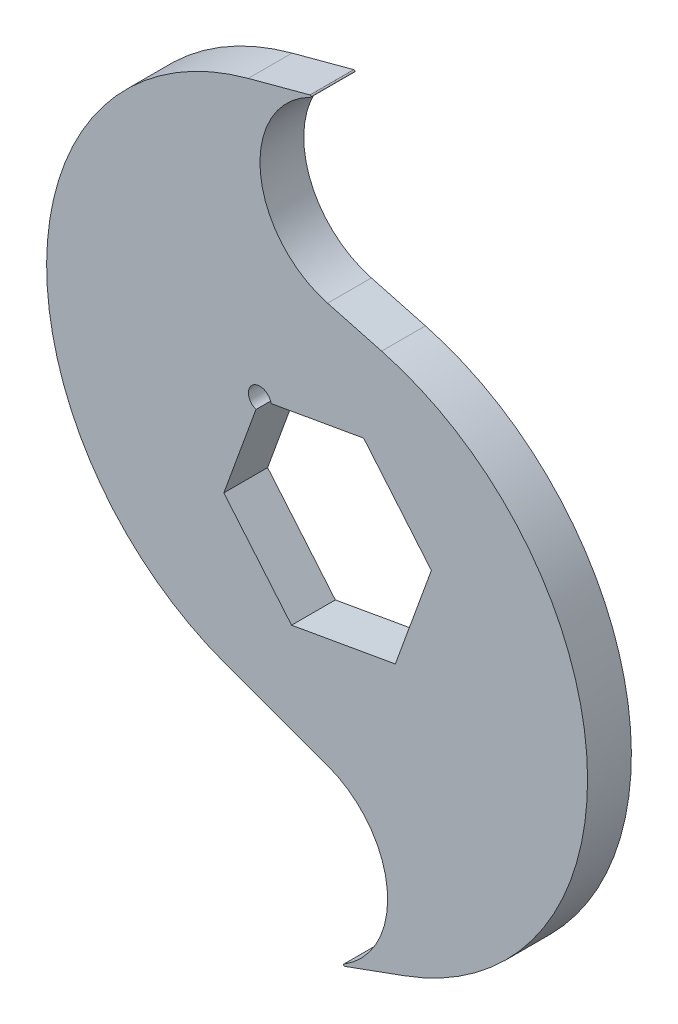
from build123d import *

# Parameters (mm, degrees)
BOSS_EXTRUDE1_DEPTH = 3.048
FILLET1_R           = 0.127


with BuildPart() as part:
    # Sketch1 → Boss-Extrude1 (new, symmetric)
    with BuildSketch(Plane.XY):
        with BuildLine():
            ThreePointArc((0, 27.535484012), (-9.412998127, 39.802742006), (0, 52.07))
            Line((0, 52.07), (-11.040532194, 49.111698314))
            ThreePointArc((-11.040532194, 49.111698314), (-39.066320922, 14.192289272), (-14.190605813, -23.03684931))
            Line((-14.190605813, -23.03684931), (0, -28.201807432))
            ThreePointArc((0, -28.201807432), (8.35634418, -40.135903716), (0, -52.07))
            Line((0, -52.07), (10.740686656, -48.160709762))
            ThreePointArc((10.740686656, -48.160709762), (36.144496882, -10.141220984), (7.52373904, 25.519504212))
            Line((7.52373904, 25.519504212), (0, 27.535484012))
        make_face()
        with BuildLine():
            Line((-14.441907141, -2.546497882), (-9.969242404, 9.742047487))
            ThreePointArc((-9.969242404, 9.742047487), (-10.446710757, 12.449905076), (-7.862903119, 11.509476004))
            Line((-7.862903119, 11.509476004), (5.015621714, 13.780307404))
            Line((5.015621714, 13.780307404), (14.441907141, 2.546497882))
            Line((14.441907141, 2.546497882), (9.426285427, -11.233809522))
            Line((9.426285427, -11.233809522), (-5.015621714, -13.780307404))
            Line((-5.015621714, -13.780307404), (-14.441907141, -2.546497882))
        make_face(mode=Mode.SUBTRACT)
    extrude(amount=BOSS_EXTRUDE1_DEPTH, both=True)

    # Fillet1
    fillet1_edges = [part.edges().sort_by_distance(p)[0] for p in [
        (0, 52.07, 0),
        (0, -52.07, 0),
    ]]
    fillet(fillet1_edges, radius=FILLET1_R)


solid = part.part
